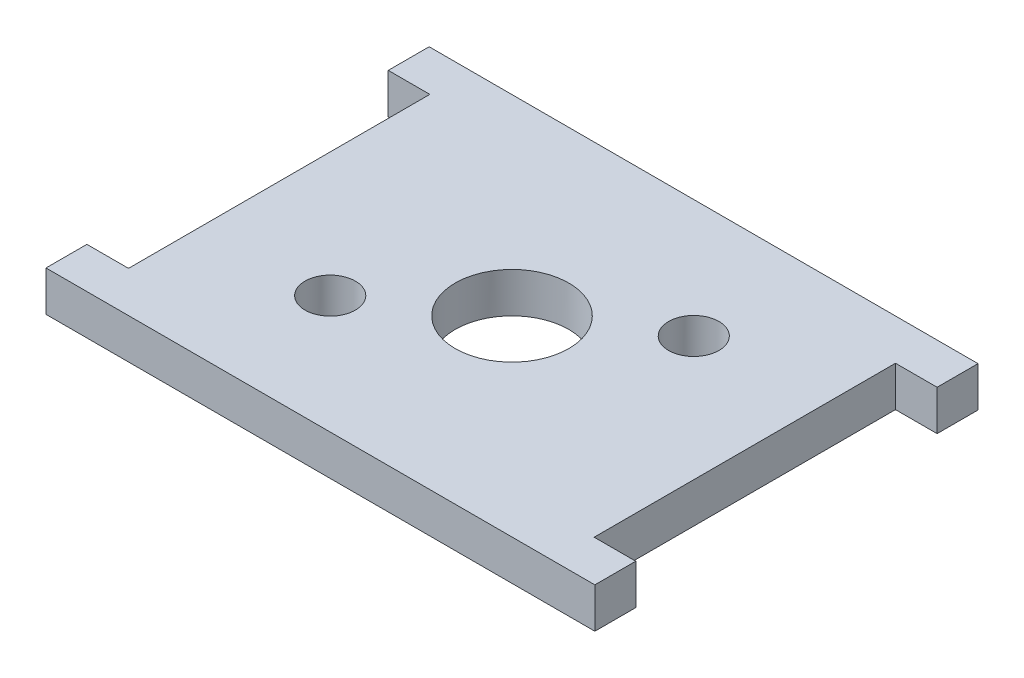
from build123d import *

# Parameters (mm, degrees)
SKETCH1_W           = 39.878
SKETCH1_H           = 27.8384
BOSS_EXTRUDE1_DEPTH = 2.921
CUT_EXTRUDE2_REACH  = 50.721
SKETCH3_W           = 3.0226
SKETCH3_H           = 21.8948
CUT_EXTRUDE1_REACH  = 50.721
SKETCH2_R           = 4.1275
SKETCH2_R_2         = 1.8288


with BuildPart() as part:
    # Sketch1 → Boss-Extrude1 (new body)
    with BuildSketch(Plane(origin=(0, 0, 0), x_dir=(1, 0, 0), z_dir=(0, 1, 0))):
        with Locations((19.939, 13.9192)):
            Rectangle(SKETCH1_W, SKETCH1_H)
    extrude(amount=BOSS_EXTRUDE1_DEPTH)

    # Sketch3 → Cut-Extrude2 (cut, up to next)
    with BuildSketch(Plane(origin=(0, 2.921, 0), x_dir=(1, 0, 0), z_dir=(0, 1, 0)), mode=Mode.PRIVATE) as cut_extrude2_sk1:
        with Locations((1.5113, 13.9192)):
            Rectangle(SKETCH3_W, SKETCH3_H)
    cut_extrude2_tool1 = extrude(cut_extrude2_sk1.sketch, amount=-CUT_EXTRUDE2_REACH, mode=Mode.PRIVATE) & part.part
    # Sketch3 → Cut-Extrude2 (cut, up to next)
    with BuildSketch(Plane(origin=(0, 2.921, 0), x_dir=(1, 0, 0), z_dir=(0, 1, 0)), mode=Mode.PRIVATE) as cut_extrude2_sk2:
        with Locations((38.3667, 13.9192)):
            Rectangle(SKETCH3_W, SKETCH3_H)
    cut_extrude2_tool2 = extrude(cut_extrude2_sk2.sketch, amount=-CUT_EXTRUDE2_REACH, mode=Mode.PRIVATE) & part.part
    add(cut_extrude2_tool1.solids().sort_by_distance((1.5113, 2.921, -13.9192))[0], mode=Mode.SUBTRACT)
    add(cut_extrude2_tool2.solids().sort_by_distance((38.3667, 2.921, -13.9192))[0], mode=Mode.SUBTRACT)

    # Sketch2 → Cut-Extrude1 (cut, up to next)
    with BuildSketch(Plane(origin=(0, 2.921, 0), x_dir=(1, 0, 0), z_dir=(0, 1, 0)), mode=Mode.PRIVATE) as cut_extrude1_sk1:
        with Locations((19.939, 13.9192)):
            Circle(SKETCH2_R)
    cut_extrude1_tool1 = extrude(cut_extrude1_sk1.sketch, amount=-CUT_EXTRUDE1_REACH, mode=Mode.PRIVATE) & part.part
    # Sketch2 → Cut-Extrude1 (cut, up to next)
    with BuildSketch(Plane(origin=(0, 2.921, 0), x_dir=(1, 0, 0), z_dir=(0, 1, 0)), mode=Mode.PRIVATE) as cut_extrude1_sk2:
        with Locations((12.065, 8.5852)):
            Circle(SKETCH2_R_2)
    cut_extrude1_tool2 = extrude(cut_extrude1_sk2.sketch, amount=-CUT_EXTRUDE1_REACH, mode=Mode.PRIVATE) & part.part
    # Sketch2 → Cut-Extrude1 (cut, up to next)
    with BuildSketch(Plane(origin=(0, 2.921, 0), x_dir=(1, 0, 0), z_dir=(0, 1, 0)), mode=Mode.PRIVATE) as cut_extrude1_sk3:
        with Locations((27.813, 19.2532)):
            Circle(SKETCH2_R_2)
    cut_extrude1_tool3 = extrude(cut_extrude1_sk3.sketch, amount=-CUT_EXTRUDE1_REACH, mode=Mode.PRIVATE) & part.part
    add(cut_extrude1_tool1.solids().sort_by_distance((19.939, 2.921, -13.9192))[0], mode=Mode.SUBTRACT)
    add(cut_extrude1_tool2.solids().sort_by_distance((12.065, 2.921, -8.5852))[0], mode=Mode.SUBTRACT)
    add(cut_extrude1_tool3.solids().sort_by_distance((27.813, 2.921, -19.2532))[0], mode=Mode.SUBTRACT)


solid = part.part
